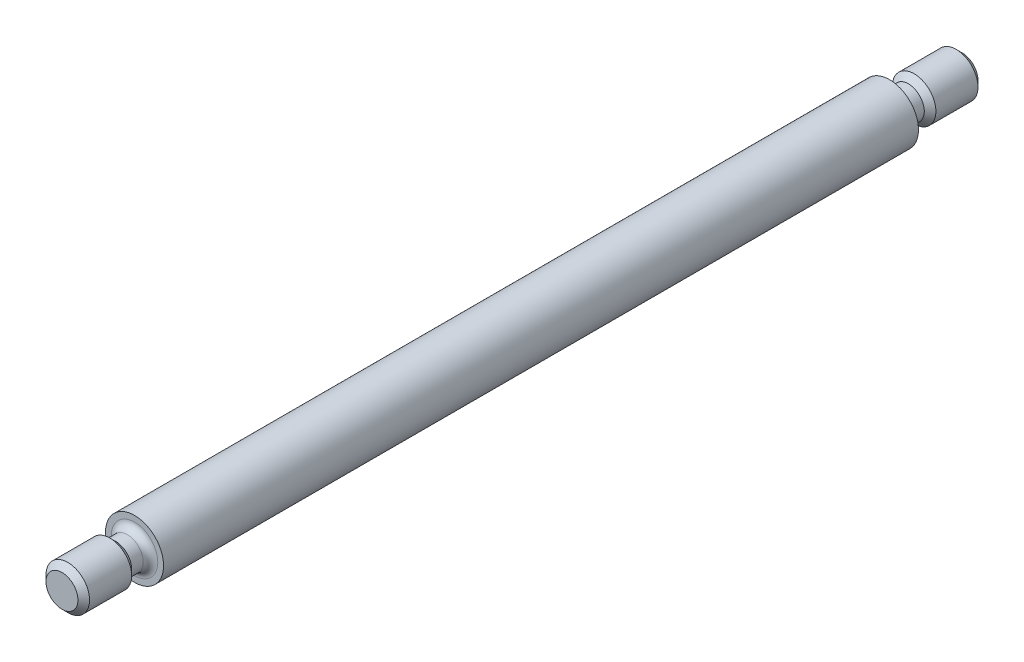
from build123d import *

# Parameters (mm, degrees)
CHAMFER_1_SIZE = 0.4
CHAMFER_2_SIZE = 0.4
FILLET_1_R     = 0.5


with BuildPart() as part:
    # Эскиз1 → Повернуть1 (revolve)
    with BuildSketch(Plane(origin=(0, 0, 0), x_dir=(1, 0, 0), z_dir=(0, 1, 0))):
        Polygon((0, 31), (-1.5, 31), (-1.5, 27.3), (-1.1, 27.3), (-1.1, 26), (-2, 26), (-2, -26), (-1.1, -26), (-1.1, -27.3), (-1.5, -27.3), (-1.5, -31), (0, -31), align=None)
    revolve(axis=Axis((0, 0, -31), (0, 0, 1)))

    # Фаска1
    chamfer_1_edges = [part.edges().sort_by_distance(p)[0] for p in [
        (1.5, 0, -31),
        (1.5, 0, 31),
    ]]
    chamfer(chamfer_1_edges, length=CHAMFER_1_SIZE)

    # Фаска2
    chamfer_2_edges = [part.edges().sort_by_distance(p)[0] for p in [
        (1.5, 0, -27.3),
        (1.5, 0, 27.3),
    ]]
    chamfer(chamfer_2_edges, length=CHAMFER_2_SIZE - 0.0001)  # a hair under: the kernel refuses the full size

    # Скругление1
    fillet_1_edges = [part.edges().sort_by_distance(p)[0] for p in [
        (1.1, 0, -26),
        (1.1, 0, 26),
    ]]
    fillet(fillet_1_edges, radius=FILLET_1_R)


solid = part.part
